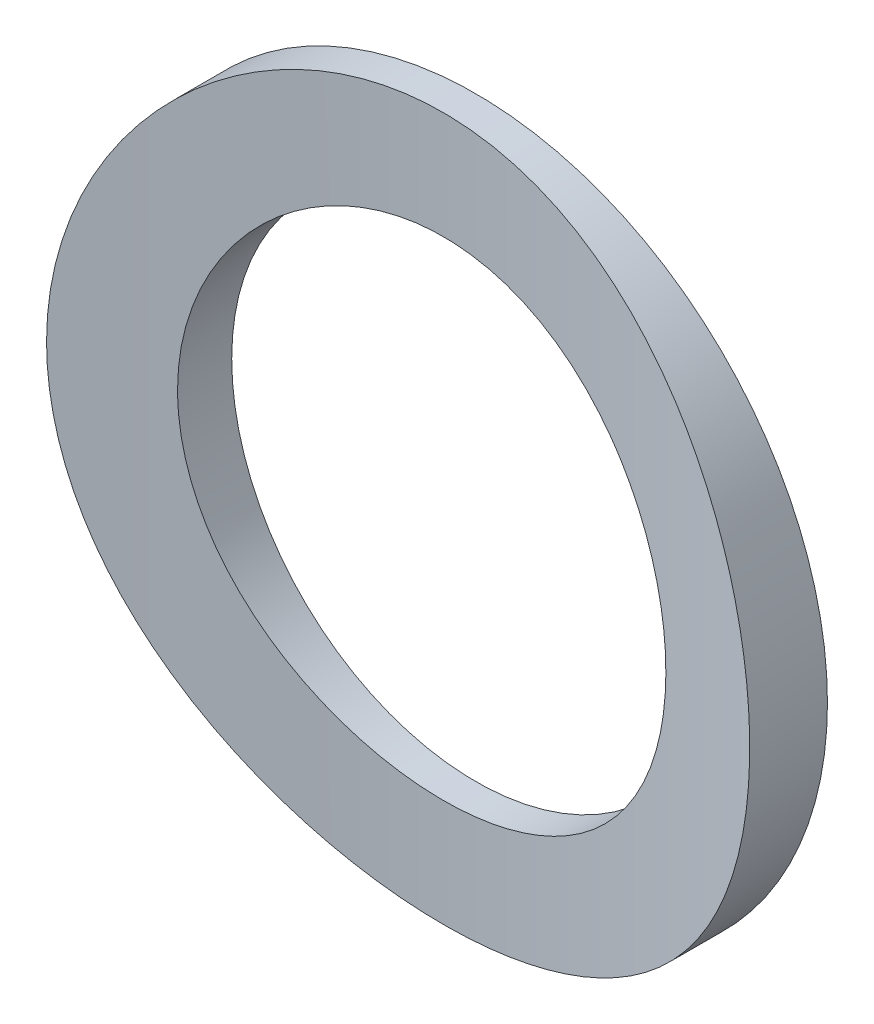
from build123d import *

# Parameters (mm, degrees)
SKETCH1_R               = 10.8
SKETCH1_R_2             = 7.5
BOSS_EXTRUDE1_DEPTH     = 30
CUT_EXTRUDE1_DEPTH      = 34.664224334
CUT_EXTRUDE1_DEPTH_BACK = 34.664224334
SKETCH2_R               = 42.725


with BuildPart() as part:
    # Sketch1 → Boss-Extrude1 (new body)
    with BuildSketch(Plane.XY):
        Circle(SKETCH1_R)
        Circle(SKETCH1_R_2, mode=Mode.SUBTRACT)
    extrude(amount=BOSS_EXTRUDE1_DEPTH)

    # Sketch2 → Cut-Extrude1 (cut, two sides: drawn at the far end of the back side and taken through both)
    with BuildSketch(Plane(origin=(0, 0, 0), x_dir=(1, 0, 0), z_dir=(0, 1, 0)).offset(-CUT_EXTRUDE1_DEPTH_BACK)):
        with Locations((0, -43.725)):
            Circle(SKETCH2_R)
    extrude(amount=CUT_EXTRUDE1_DEPTH + CUT_EXTRUDE1_DEPTH_BACK, mode=Mode.SUBTRACT)


solid = part.part
